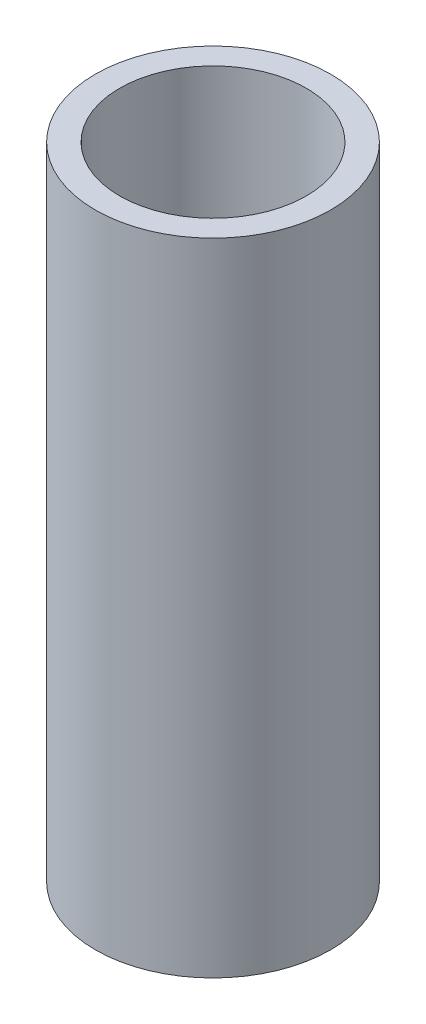
from build123d import *

# Parameters (mm, degrees)
SKETCH1_R           = 27.5
BOSS_EXTRUDE1_DEPTH = 149.741743272
SKETCH2_R           = 21.81289083
CUT_EXTRUDE1_DEPTH  = 155.709694842


with BuildPart() as part:
    # Sketch1 → Boss-Extrude1 (new body)
    with BuildSketch(Plane(origin=(0, 0, 0), x_dir=(1, 0, 0), z_dir=(0, 1, 0))):
        Circle(SKETCH1_R)
    extrude(amount=BOSS_EXTRUDE1_DEPTH)

    # Sketch2 → Cut-Extrude1 (cut, through all)
    with BuildSketch(Plane(origin=(0, 0, 0), x_dir=(1, 0, 0), z_dir=(0, 1, 0))):
        Circle(SKETCH2_R)
    extrude(amount=CUT_EXTRUDE1_DEPTH, mode=Mode.SUBTRACT)


solid = part.part
